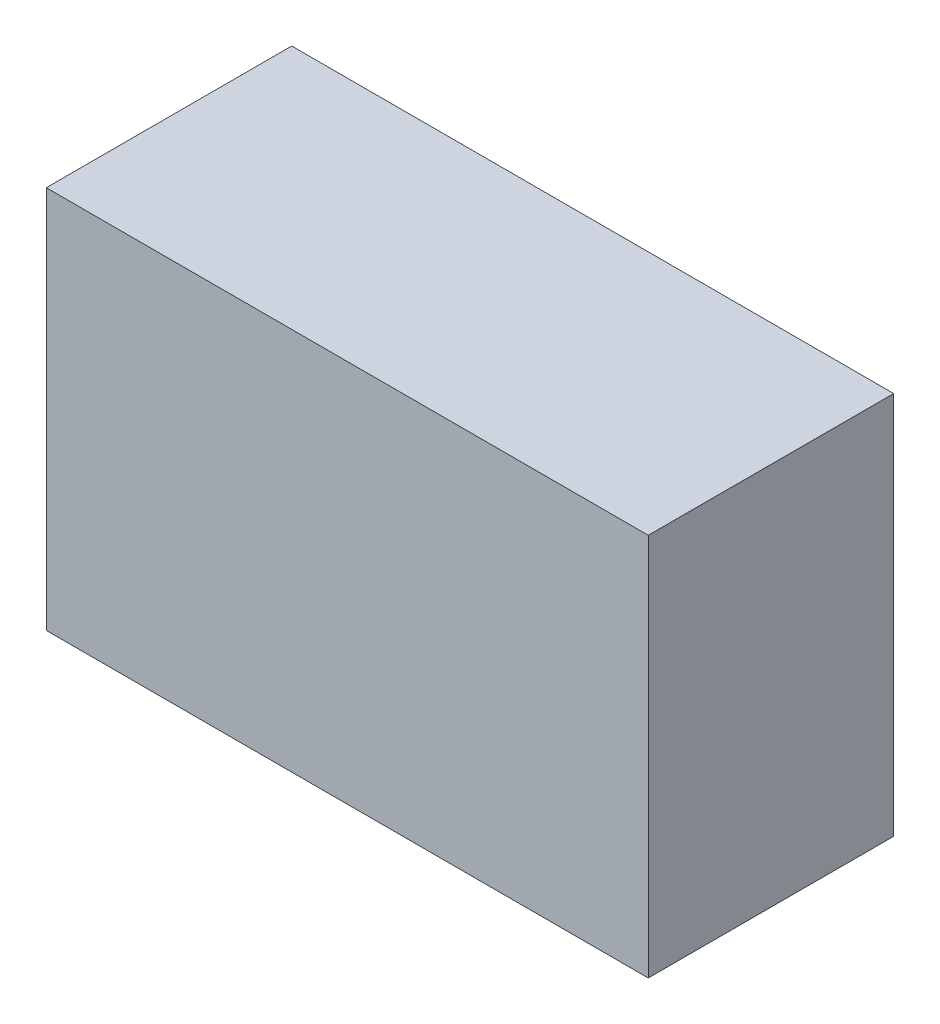
from build123d import *
from build123d.topology import SkipClean

# Parameters (mm, degrees)
SKETCH3_W                      = 31.148374891
SKETCH3_H                      = 19.837641971
BOSS_EXTRUDE1_DEPTH            = 6.35
SKETCH4_R                      = 3.175
CUT_EXTRUDE1_DEPTH             = 9.525
SKETCH5_R                      = 3.175
CUT_EXTRUDE5_DEPTH             = 9.525
CUT_EXTRUDE5_DIRECTION_2_REACH = 33.299
SKETCH6_R                      = 3.175
CUT_EXTRUDE6_DEPTH             = 9.525


with BuildPart() as part:
    # Sketch3 → Boss-Extrude1 (new, symmetric)
    with BuildSketch(Plane.XY):
        with Locations((15.574187446, -9.918820986)):
            Rectangle(SKETCH3_W, SKETCH3_H)
    extrude(amount=BOSS_EXTRUDE1_DEPTH, both=True)

    # Sketch4 → Cut-Extrude1 (cut)
    with BuildSketch(Plane.ZY):
        with Locations((0, -6.35)):
            Circle(SKETCH4_R)
    extrude(amount=-CUT_EXTRUDE1_DEPTH, mode=Mode.SUBTRACT)

    # Sketch5 → Cut-Extrude5 (cut)
    with BuildSketch(Plane(origin=(7.787093723, -19.837641971, 0), x_dir=(-0.8660254037844382, 0.500000000000001, 0), z_dir=(-0.500000000000001, -0.8660254037844382, 0))):
        Circle(SKETCH5_R)
    cut_extrude5 = extrude(amount=-CUT_EXTRUDE5_DEPTH, mode=Mode.SUBTRACT)

    # Sketch5 → Cut-Extrude5 direction 2 (cut, up to next)
    with BuildSketch(Plane(origin=(7.787093723, -19.837641971, 0), x_dir=(-0.8660254037844382, 0.500000000000001, 0), z_dir=(-0.500000000000001, -0.8660254037844382, 0)), mode=Mode.PRIVATE) as cut_extrude5_direction_2_sk1:
        Circle(SKETCH5_R)
    cut_extrude5_direction_2_tool1 = extrude(cut_extrude5_direction_2_sk1.sketch, amount=CUT_EXTRUDE5_DIRECTION_2_REACH, mode=Mode.PRIVATE) & part.part
    cut_extrude5_direction_2 = cut_extrude5_direction_2_tool1.solids().sort_by_distance((7.787094, -19.837642, 0))[0]
    add(cut_extrude5_direction_2, mode=Mode.SUBTRACT)

    # Sketch6 → Cut-Extrude6 (cut)
    with BuildSketch(Plane(origin=(0, 0, -6.35), x_dir=(-1, 0, 0), z_dir=(0, 0, -1))):
        with Locations((-15.574187445, -6.35)):
            Circle(SKETCH6_R)
    extrude(amount=-CUT_EXTRUDE6_DEPTH, mode=Mode.SUBTRACT)

    # Mirror1: Cut-Extrude5, Cut-Extrude5 direction 2 across plane
    with SkipClean():  # the faces are left unmerged after this step: merging them gives an invalid solid
        add(cut_extrude5.mirror(Plane.ZY.offset(-15.574187445)), mode=Mode.SUBTRACT)
        add(cut_extrude5_direction_2.mirror(Plane.ZY.offset(-15.574187445)), mode=Mode.SUBTRACT)


solid = part.part
